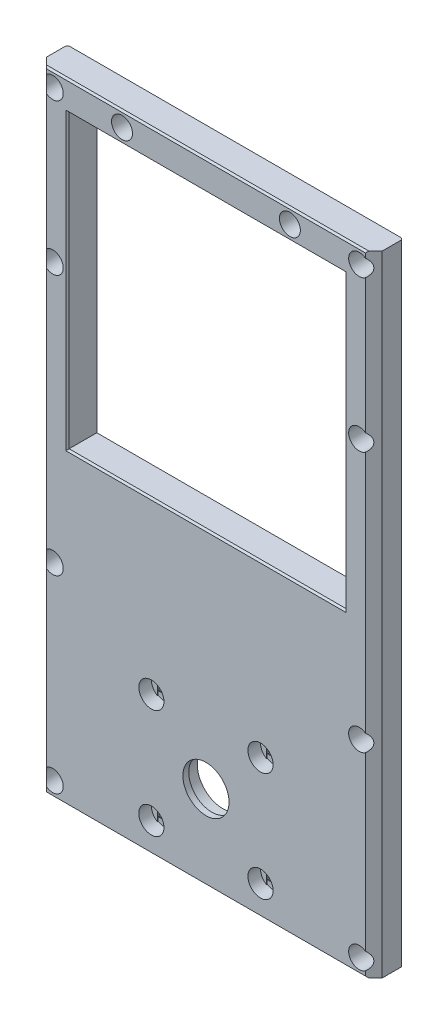
from build123d import *

# Parameters (mm, degrees)
SKETCH1_W           = 80
SKETCH1_H           = 150
SKETCH1_W_2         = 66
SKETCH1_H_2         = 136
BOSS_EXTRUDE1_DEPTH = 7
SKETCH2_W           = 66
SKETCH2_H           = 36
BOSS_EXTRUDE2_DEPTH = 7
SKETCH3_R           = 5.5
CUT_EXTRUDE1_DEPTH  = 86.287748241
SKETCH4_R           = 6.05
CUT_EXTRUDE2_DEPTH  = 5.6
SKETCH5_R           = 11
CUT_EXTRUDE3_DEPTH  = 3
SKETCH6_R           = 1.6
CUT_EXTRUDE4_DEPTH  = 86.287748241
SKETCH7_W           = 50
SKETCH7_H           = 38
CUT_EXTRUDE5_DEPTH  = 1
SKETCH8_R           = 3
CUT_EXTRUDE6_DEPTH  = 3
SKETCH9_R           = 1.35
CUT_EXTRUDE7_DEPTH  = 86.287748241
SKETCH10_R          = 2.5
CUT_EXTRUDE8_DEPTH  = 5
CHAMFER1_SIZE       = 2
SKETCH11_W          = 66
SKETCH11_H          = 30.5
BOSS_EXTRUDE3_DEPTH = 7
CUT_EXTRUDE9_DEPTH  = 0.2
SKETCH13_W          = 2.7
SKETCH13_H          = 2.7
CUT_EXTRUDE10_DEPTH = 0.2
CUT_EXTRUDE11_DEPTH = 0.2
SKETCH15_W          = 3.2
SKETCH15_H          = 3.2
CUT_EXTRUDE12_DEPTH = 0.2
CHAMFER2_SIZE       = 0.4
CHAMFER3_SIZE       = 0.4
SKETCH16_W          = 2
SKETCH16_H          = 4
BOSS_EXTRUDE4_DEPTH = 1
LPATTERN1_COUNT     = 2
LPATTERN1_PITCH     = 20
LPATTERN1_COL_COUNT = 2
LPATTERN1_COL_PITCH = 20
SKETCH17_R          = 1.35
CUT_EXTRUDE13_DEPTH = 86.287748241
SKETCH18_R          = 2.5
CUT_EXTRUDE14_DEPTH = 5
CUT_EXTRUDE15_DEPTH = 0.2
SKETCH20_W          = 2.7
SKETCH20_H          = 2.7
CUT_EXTRUDE16_DEPTH = 0.2


with BuildPart() as part:
    # Sketch1 → Boss-Extrude1 (new body)
    with BuildSketch(Plane.XY):
        Rectangle(SKETCH1_W, SKETCH1_H)
        Rectangle(SKETCH1_W_2, SKETCH1_H_2, mode=Mode.SUBTRACT)
    extrude(amount=BOSS_EXTRUDE1_DEPTH)

    # Sketch2 → Boss-Extrude2 (add)
    with BuildSketch(Plane.XY.offset(7)):
        with Locations((0, -50)):
            Rectangle(SKETCH2_W, SKETCH2_H)
    extrude(amount=-BOSS_EXTRUDE2_DEPTH)

    # Sketch3 → Cut-Extrude1 (cut, through all)
    with BuildSketch(Plane(origin=(0, 0, 0), x_dir=(-1, 0, 0), z_dir=(0, 0, -1))):
        with Locations((0, -55)):
            Circle(SKETCH3_R)
    extrude(amount=-CUT_EXTRUDE1_DEPTH, mode=Mode.SUBTRACT)

    # Sketch4 → Cut-Extrude2 (cut)
    with BuildSketch(Plane(origin=(0, 0, 0), x_dir=(-1, 0, 0), z_dir=(0, 0, -1))):
        with Locations((0, -55)):
            Circle(SKETCH4_R)
    extrude(amount=-CUT_EXTRUDE2_DEPTH, mode=Mode.SUBTRACT)

    # Sketch5 → Cut-Extrude3 (cut)
    with BuildSketch(Plane(origin=(0, 0, 0), x_dir=(-1, 0, 0), z_dir=(0, 0, -1))):
        with Locations((0, -55)):
            Circle(SKETCH5_R)
    extrude(amount=-CUT_EXTRUDE3_DEPTH, mode=Mode.SUBTRACT)

    # Sketch6 → Cut-Extrude4 (cut, through all)
    with BuildSketch(Plane(origin=(0, 0, 0), x_dir=(-1, 0, 0), z_dir=(0, 0, -1))):
        with Locations((-13, -42)):
            Circle(SKETCH6_R)
        with Locations((13, -42)):
            Circle(SKETCH6_R)
        with Locations((13, -68)):
            Circle(SKETCH6_R)
        with Locations((-13, -68)):
            Circle(SKETCH6_R)
    extrude(amount=-CUT_EXTRUDE4_DEPTH, mode=Mode.SUBTRACT)

    # Sketch7 → Cut-Extrude5 (cut)
    with BuildSketch(Plane(origin=(0, 0, 0), x_dir=(-1, 0, 0), z_dir=(0, 0, -1))):
        with Locations((0, -55)):
            Rectangle(SKETCH7_W, SKETCH7_H)
    extrude(amount=-CUT_EXTRUDE5_DEPTH, mode=Mode.SUBTRACT)

    # Sketch8 → Cut-Extrude6 (cut)
    with BuildSketch(Plane.XY.offset(7)):
        with Locations((-13, -42)):
            Circle(SKETCH8_R)
        with Locations((13, -42)):
            Circle(SKETCH8_R)
        with Locations((13, -68)):
            Circle(SKETCH8_R)
        with Locations((-13, -68)):
            Circle(SKETCH8_R)
    extrude(amount=-CUT_EXTRUDE6_DEPTH, mode=Mode.SUBTRACT)

    # Sketch9 → Cut-Extrude7 (cut, through all)
    with BuildSketch(Plane.XY.offset(7)):
        with Locations((-36.5, 71.5)):
            Circle(SKETCH9_R)
        with Locations((36.5, 71.5)):
            Circle(SKETCH9_R)
        with Locations((36.5, -71.5)):
            Circle(SKETCH9_R)
        with Locations((-36.5, -71.5)):
            Circle(SKETCH9_R)
        with Locations((-36.5, 35.5)):
            Circle(SKETCH9_R)
        with Locations((-36.5, -26.5)):
            Circle(SKETCH9_R)
        with Locations((36.5, -26.5)):
            Circle(SKETCH9_R)
        with Locations((36.5, 35.5)):
            Circle(SKETCH9_R)
    extrude(amount=-CUT_EXTRUDE7_DEPTH, mode=Mode.SUBTRACT)

    # Sketch10 → Cut-Extrude8 (cut)
    with BuildSketch(Plane.XY.offset(7)):
        with Locations((-36.5, 71.5)):
            Circle(SKETCH10_R)
        with Locations((36.5, 71.5)):
            Circle(SKETCH10_R)
        with Locations((-36.5, 35.5)):
            Circle(SKETCH10_R)
        with Locations((-36.5, -26.5)):
            Circle(SKETCH10_R)
        with Locations((-36.5, -71.5)):
            Circle(SKETCH10_R)
        with Locations((36.5, -71.5)):
            Circle(SKETCH10_R)
        with Locations((36.5, 35.5)):
            Circle(SKETCH10_R)
        with Locations((36.5, -26.5)):
            Circle(SKETCH10_R)
    extrude(amount=-CUT_EXTRUDE8_DEPTH, mode=Mode.SUBTRACT)

    # Chamfer1
    # the kernel refuses this chamfer: 2 mm, written as the material it takes off along each edge
    with BuildSketch(Plane(origin=(-40, 80.143365976, 7), x_dir=(-0.027495876610585623, 0, -0.9996219169112968), z_dir=(0, -1, 0)), Plane(origin=(40, -80.143365976, 7), x_dir=(0.027495876610585623, 0, -0.9996219169112968), z_dir=(0, 1, 0))) as chamfer1_piece_1:
        Polygon((CHAMFER1_SIZE * 0.999621916911, CHAMFER1_SIZE * 0.0274958766106), (-CHAMFER1_SIZE * 0.0274958766106, CHAMFER1_SIZE * 0.999621916911), (0, 0), align=None)
    extrude(amount=160.286731952, mode=Mode.SUBTRACT)

    # Sketch11 → Boss-Extrude3 (add)
    with BuildSketch(Plane.XY.offset(7)):
        with Locations((0, -16.75)):
            Rectangle(SKETCH11_W, SKETCH11_H)
    extrude(amount=-BOSS_EXTRUDE3_DEPTH)

    # Sketch12 → Cut-Extrude9 (cut)
    with BuildSketch(Plane.XY.offset(2)):
        with BuildLine():
            Line((-37.85, -73.604162541), (-37.85, -69.395837459))
            ThreePointArc((-37.85, -69.395837459), (-36.5, -69), (-35.15, -69.395837459))
            Line((-35.15, -69.395837459), (-35.15, -73.604162541))
            ThreePointArc((-35.15, -73.604162541), (-36.5, -74), (-37.85, -73.604162541))
        make_face()
        with BuildLine():
            Line((-37.85, -28.604162541), (-37.85, -24.395837459))
            ThreePointArc((-37.85, -24.395837459), (-36.5, -24), (-35.15, -24.395837459))
            Line((-35.15, -24.395837459), (-35.15, -28.604162541))
            ThreePointArc((-35.15, -28.604162541), (-36.5, -29), (-37.85, -28.604162541))
        make_face()
        with BuildLine():
            Line((-37.85, 33.395837459), (-37.85, 37.604162541))
            ThreePointArc((-37.85, 37.604162541), (-36.5, 38), (-35.15, 37.604162541))
            Line((-35.15, 37.604162541), (-35.15, 33.395837459))
            ThreePointArc((-35.15, 33.395837459), (-36.5, 33), (-37.85, 33.395837459))
        make_face()
        with BuildLine():
            Line((-37.85, 69.395837459), (-37.85, 73.604162541))
            ThreePointArc((-37.85, 73.604162541), (-36.5, 74), (-35.15, 73.604162541))
            Line((-35.15, 73.604162541), (-35.15, 69.395837459))
            ThreePointArc((-35.15, 69.395837459), (-36.5, 69), (-37.85, 69.395837459))
        make_face()
    cut_extrude9 = extrude(amount=-CUT_EXTRUDE9_DEPTH, mode=Mode.SUBTRACT)

    # Sketch13 → Cut-Extrude10 (cut)
    with BuildSketch(Plane.XY.offset(1.8)):
        with Locations((-36.5, -71.5)):
            Rectangle(SKETCH13_W, SKETCH13_H)
        with Locations((-36.5, -26.5)):
            Rectangle(SKETCH13_W, SKETCH13_H)
        with Locations((-36.5, 35.5)):
            Rectangle(SKETCH13_W, SKETCH13_H)
        with Locations((-36.5, 71.5)):
            Rectangle(SKETCH13_W, SKETCH13_H)
    cut_extrude10 = extrude(amount=-CUT_EXTRUDE10_DEPTH, mode=Mode.SUBTRACT)

    # Sketch14 → Cut-Extrude11 (cut)
    with BuildSketch(Plane.XY.offset(4)):
        with BuildLine():
            Line((-14.6, -44.537715508), (-14.6, -39.462284492))
            ThreePointArc((-14.6, -39.462284492), (-13, -39), (-11.4, -39.462284492))
            Line((-11.4, -39.462284492), (-11.4, -44.537715508))
            ThreePointArc((-11.4, -44.537715508), (-13, -45), (-14.6, -44.537715508))
        make_face()
        with BuildLine():
            Line((-14.6, -70.537715508), (-14.6, -65.462284492))
            ThreePointArc((-14.6, -65.462284492), (-13, -65), (-11.4, -65.462284492))
            Line((-11.4, -65.462284492), (-11.4, -70.537715508))
            ThreePointArc((-11.4, -70.537715508), (-13, -71), (-14.6, -70.537715508))
        make_face()
    cut_extrude11 = extrude(amount=-CUT_EXTRUDE11_DEPTH, mode=Mode.SUBTRACT)

    # Sketch15 → Cut-Extrude12 (cut)
    with BuildSketch(Plane.XY.offset(3.8)):
        with Locations((-13, -42)):
            Rectangle(SKETCH15_W, SKETCH15_H)
        with Locations((-13, -68)):
            Rectangle(SKETCH15_W, SKETCH15_H)
    cut_extrude12 = extrude(amount=-CUT_EXTRUDE12_DEPTH, mode=Mode.SUBTRACT)

    # Mirror1: Cut-Extrude9, Cut-Extrude10, Cut-Extrude11, Cut-Extrude12 across plane
    add(cut_extrude9.mirror(Plane(origin=(0, 0, 0), x_dir=(0, 0, 1), z_dir=(1, 0, 0))), mode=Mode.SUBTRACT)
    add(cut_extrude10.mirror(Plane(origin=(0, 0, 0), x_dir=(0, 0, 1), z_dir=(1, 0, 0))), mode=Mode.SUBTRACT)
    add(cut_extrude11.mirror(Plane(origin=(0, 0, 0), x_dir=(0, 0, 1), z_dir=(1, 0, 0))), mode=Mode.SUBTRACT)
    add(cut_extrude12.mirror(Plane(origin=(0, 0, 0), x_dir=(0, 0, 1), z_dir=(1, 0, 0))), mode=Mode.SUBTRACT)

    # Chamfer2
    chamfer2_edges = [part.edges().sort_by_distance(p)[0] for p in [
        (0, 68, 7),
        (-33, 33.25, 7),
        (33, 33.25, 7),
        (0, -1.5, 7),
    ]]
    chamfer(chamfer2_edges, length=CHAMFER2_SIZE)

    # Chamfer3
    chamfer3_edges = [part.edges().sort_by_distance(p)[0] for p in [
        (0, 75, 7),
        (0, -75, 7),
        (-40, 0, 0),
        (40, 0, 0),
    ]]
    chamfer(chamfer3_edges, length=CHAMFER3_SIZE)

    # Sketch16 → Boss-Extrude4 (add, symmetric)
    # profile 1 of 2: a face of its own
    with BuildSketch(Plane(origin=(0, 0, 0), x_dir=(0, 0, -1), z_dir=(1, 0, 0))):
        Polygon((0, -4), (0, -15.4), (3.2, -12.2), (3.2, -7.2), align=None)
        with Locations((1.6, -9.7)):
            Rectangle(SKETCH16_W, SKETCH16_H, mode=Mode.SUBTRACT)
    # profile 2 of 2: a face of its own
    with BuildSketch(Plane(origin=(0, 0, 0), x_dir=(0, 0, -1), z_dir=(1, 0, 0))):
        Polygon((3.2, -27.6), (0, -30.8), (0, -19.4), (3.2, -22.6), align=None)
        with Locations((1.6, -25.1)):
            Rectangle(SKETCH16_W, SKETCH16_H, mode=Mode.SUBTRACT)
    boss_extrude4 = extrude(amount=BOSS_EXTRUDE4_DEPTH, both=True)

    # LPattern1: Boss-Extrude4 ×2
    with Locations(*[(i * LPATTERN1_PITCH, 0, 0) for i in range(1, LPATTERN1_COUNT)]):
        add(boss_extrude4)

    # LPattern1 col: Boss-Extrude4 ×2
    with Locations(*[(-i * LPATTERN1_COL_PITCH, 0, 0) for i in range(1, LPATTERN1_COL_COUNT)]):
        add(boss_extrude4)

    # Sketch17 → Cut-Extrude13 (cut, through all)
    with BuildSketch(Plane(origin=(0, 0, 0), x_dir=(-1, 0, 0), z_dir=(0, 0, -1))):
        with Locations((-20, 71.5)):
            Circle(SKETCH17_R)
        with Locations((20, 71.5)):
            Circle(SKETCH17_R)
    extrude(amount=-CUT_EXTRUDE13_DEPTH, mode=Mode.SUBTRACT)

    # Sketch18 → Cut-Extrude14 (cut)
    with BuildSketch(Plane.XY.offset(7)):
        with Locations((-20, 71.5)):
            Circle(SKETCH18_R)
        with Locations((20, 71.5)):
            Circle(SKETCH18_R)
    extrude(amount=-CUT_EXTRUDE14_DEPTH, mode=Mode.SUBTRACT)

    # Sketch19 → Cut-Extrude15 (cut)
    with BuildSketch(Plane.XY.offset(2)):
        with BuildLine():
            Line((-21.35, 69.395837459), (-21.35, 73.604162541))
            ThreePointArc((-21.35, 73.604162541), (-20, 74), (-18.65, 73.604162541))
            Line((-18.65, 73.604162541), (-18.65, 69.395837459))
            ThreePointArc((-18.65, 69.395837459), (-20, 69), (-21.35, 69.395837459))
        make_face()
        with BuildLine():
            Line((18.65, 69.395837459), (18.65, 73.604162541))
            ThreePointArc((18.65, 73.604162541), (20, 74), (21.35, 73.604162541))
            Line((21.35, 73.604162541), (21.35, 69.395837459))
            ThreePointArc((21.35, 69.395837459), (20, 69), (18.65, 69.395837459))
        make_face()
    extrude(amount=-CUT_EXTRUDE15_DEPTH, mode=Mode.SUBTRACT)

    # Sketch20 → Cut-Extrude16 (cut)
    with BuildSketch(Plane.XY.offset(1.8)):
        with Locations((-20, 71.5)):
            Rectangle(SKETCH20_W, SKETCH20_H)
        with Locations((20, 71.5)):
            Rectangle(SKETCH20_W, SKETCH20_H)
    extrude(amount=-CUT_EXTRUDE16_DEPTH, mode=Mode.SUBTRACT)


solid = part.part
